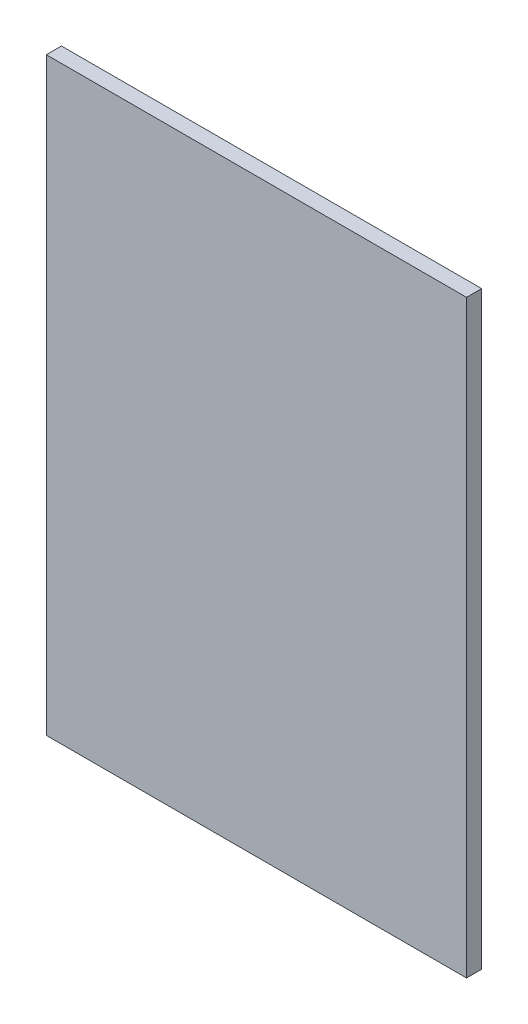
from build123d import *

# Parameters (mm, degrees)
CROQUIS1_W              = 139
CROQUIS1_H              = 195
SALIENTE_EXTRUIR1_DEPTH = 5


with BuildPart() as part:
    # Croquis1 → Saliente-Extruir1 (new body)
    with BuildSketch(Plane.XY):
        Rectangle(CROQUIS1_W, CROQUIS1_H)
    extrude(amount=SALIENTE_EXTRUIR1_DEPTH)


solid = part.part
